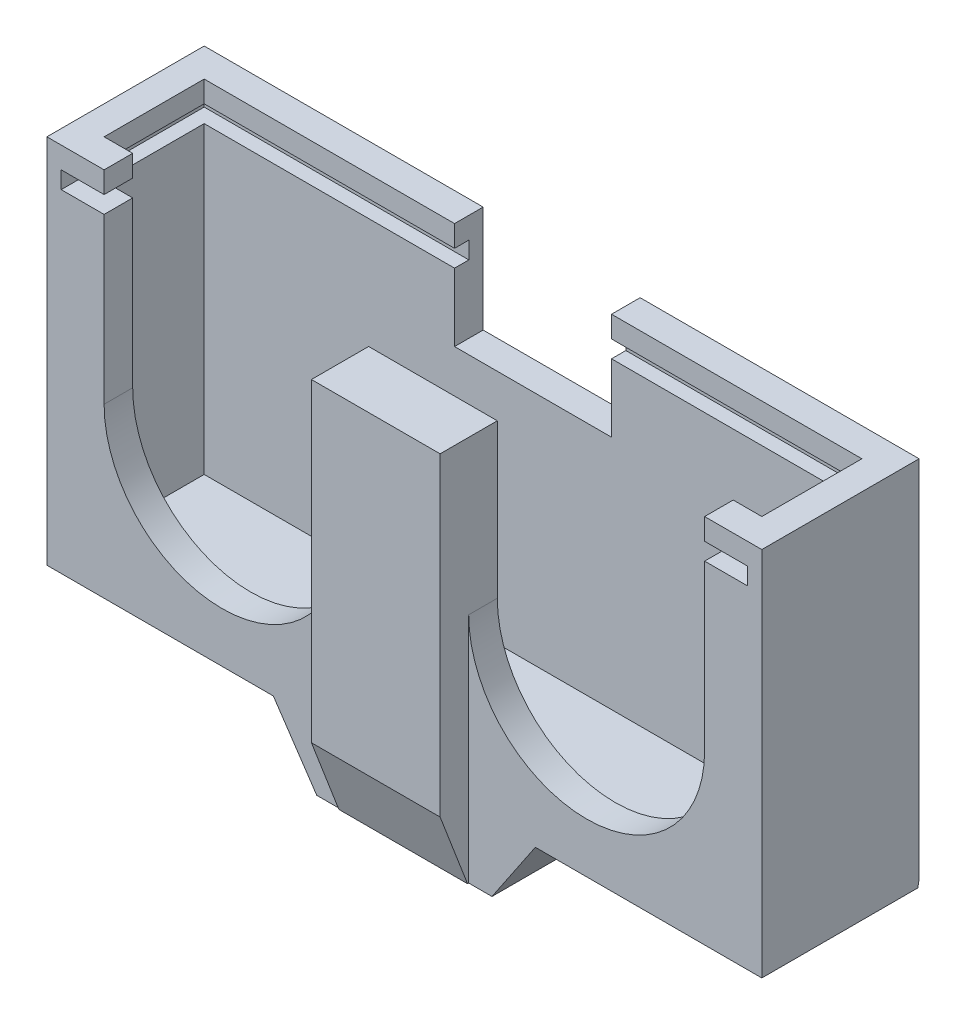
from build123d import *

# Parameters (mm, degrees)
ESBO_O1_W                 = 50
ESBO_O1_H                 = 11
RESSALTO_EXTRUS_O1_DEPTH  = 22.5
ESBO_O2_W                 = 46
ESBO_O2_H                 = 7
CORTE_EXTRUS_O1_DEPTH     = 20.5
ESBO_O3_W                 = 10.97916057
ESBO_O3_H                 = 2
CORTE_EXTRUS_O2_DEPTH     = 4
CORTE_EXTRUS_O3_DEPTH     = 4
ESBO_O9_W                 = 50
ESBO_O9_H                 = 4
RESSALTO_EXTRUS_O4_DEPTH  = 7
ESBO_O13_R                = 1.5
CORTE_EXTRUS_O4_DEPTH     = 7
ESBO_O19_W                = 9
ESBO_O19_H                = 4
RESSALTO_EXTRUS_O5_DEPTH  = 22.5
ESBO_O20_W                = 50
ESBO_O20_H                = 4
CORTE_EXTRUS_O5_DEPTH     = 7
RESSALTO_EXTRUS_O6_DEPTH  = 0.75
RESSALTO_EXTRUS_O7_DEPTH  = 1.2
RESSALTO_EXTRUS_O8_DEPTH  = 1.5
RESSALTO_EXTRUS_O9_DEPTH  = 4.5
ESBO_O26_R                = 2.9
CORTE_EXTRUS_O6_DEPTH     = 4
ESBO_O28_W                = 7
ESBO_O28_H                = 7
RESSALTO_EXTRUS_O10_DEPTH = 4.5
CHANFRO1_SIZE             = 5
CHANFRO1_SIZE_2           = 3.372542584
CHANFRO2_SIZE             = 3.372542584
CHANFRO2_SIZE_2           = 5
CHANFRO3_SIZE             = 5
CHANFRO3_SIZE2            = 0.881634904
CHANFRO4_SIZE             = 5
CHANFRO4_SIZE2            = 1.919320175


with BuildPart() as part:
    # Esboço1 → Ressalto-extrusão1 (new body)
    with BuildSketch(Plane(origin=(0, 0, 0), x_dir=(1, 0, 0), z_dir=(0, 1, 0))):
        Rectangle(ESBO_O1_W, ESBO_O1_H)
    extrude(amount=RESSALTO_EXTRUS_O1_DEPTH)

    # Esboço2 → Corte-extrusão1 (cut)
    with BuildSketch(Plane(origin=(0, 22.5, 0), x_dir=(1, 0, 0), z_dir=(0, 1, 0))):
        Rectangle(ESBO_O2_W, ESBO_O2_H)
    extrude(amount=-CORTE_EXTRUS_O1_DEPTH, mode=Mode.SUBTRACT)

    # Esboço3 → Corte-extrusão2 (cut)
    with BuildSketch(Plane(origin=(0, 22.5, 0), x_dir=(1, 0, 0), z_dir=(0, 1, 0))):
        with Locations((0, 4.5)):
            Rectangle(ESBO_O3_W, ESBO_O3_H)
    extrude(amount=-CORTE_EXTRUS_O2_DEPTH, mode=Mode.SUBTRACT)

    # Esboço5 → Corte-extrusão3 (cut)
    with BuildSketch(Plane.XY.offset(5.5)):
        with BuildLine():
            Line((-21, 22.5), (-4.5, 22.5))
            Line((-4.5, 22.5), (-4.5, 11.75))
            ThreePointArc((-4.5, 11.75), (-12.75, 3.5), (-21, 11.75))
            Line((-21, 11.75), (-21, 22.5))
        make_face()
        with BuildLine():
            Line((4.5, 22.5), (21, 22.5))
            Line((21, 22.5), (21, 11.75))
            ThreePointArc((21, 11.75), (12.75, 3.5), (4.5, 11.75))
            Line((4.5, 11.75), (4.5, 22.5))
        make_face()
    extrude(amount=-CORTE_EXTRUS_O3_DEPTH, mode=Mode.SUBTRACT)

    # Esboço9 → Ressalto-extrusão4 (add)
    with BuildSketch(Plane(origin=(0, 0, -5.5), x_dir=(-1, 0, 0), z_dir=(0, 0, -1))):
        with Locations((0, 2)):
            Rectangle(ESBO_O9_W, ESBO_O9_H)
    extrude(amount=RESSALTO_EXTRUS_O4_DEPTH)

    # Esboço13 → Corte-extrusão4 (cut)
    with BuildSketch(Plane(origin=(0, 4, 0), x_dir=(1, 0, 0), z_dir=(0, 1, 0))):
        with Locations(Location((10, 9, 0), (0, 0, 270))):
            Circle(ESBO_O13_R)
        with Locations(Location((5, 9, 0), (0, 0, 270))):
            Circle(ESBO_O13_R)
        with Locations(Location((20, 9, 0), (0, 0, 270))):
            Circle(ESBO_O13_R)
        with Locations(Location((15, 9, 0), (0, 0, 270))):
            Circle(ESBO_O13_R)
        with Locations(Location((0, 9, 0), (0, 0, 270))):
            Circle(ESBO_O13_R)
        with Locations(Location((-5, 9, 0), (0, 0, 270))):
            Circle(ESBO_O13_R)
        with Locations(Location((-10, 9, 0), (0, 0, 270))):
            Circle(ESBO_O13_R)
        with Locations(Location((-15, 9, 0), (0, 0, 270))):
            Circle(ESBO_O13_R)
        with Locations(Location((-20, 9, 0), (0, 0, 270))):
            Circle(ESBO_O13_R)
    extrude(amount=-CORTE_EXTRUS_O4_DEPTH, mode=Mode.SUBTRACT)

    # Esboço19 → Ressalto-extrusão5 (add)
    with BuildSketch(Plane(origin=(0, 22.5, 0), x_dir=(1, 0, 0), z_dir=(0, 1, 0))):
        with Locations((0, -5.5)):
            Rectangle(ESBO_O19_W, ESBO_O19_H)
    extrude(amount=-RESSALTO_EXTRUS_O5_DEPTH)

    # Esboço20 → Corte-extrusão5 (cut)
    with BuildSketch(Plane(origin=(0, 0, -12.5), x_dir=(-1, 0, 0), z_dir=(0, 0, -1))):
        with Locations((0, 2)):
            Rectangle(ESBO_O20_W, ESBO_O20_H)
    extrude(amount=-CORTE_EXTRUS_O5_DEPTH, mode=Mode.SUBTRACT)

    # Esboço21 → Ressalto-extrusão6 (add)
    with BuildSketch(Plane(origin=(0, 22.5, 0), x_dir=(1, 0, 0), z_dir=(0, 1, 0))):
        Polygon((-21, -5.5), (-21, -3.5), (-23, -3.5), (-23, 3.5), (-5.489580285, 3.5), (-5.489580285, 5.5), (-25, 5.5), (-25, -5.5), align=None)
        Polygon((21, -3.5), (21, -5.5), (25, -5.5), (25, 5.5), (5.489580285, 5.5), (5.489580285, 3.5), (23, 3.5), (23, -3.5), align=None)
    extrude(amount=RESSALTO_EXTRUS_O6_DEPTH)

    # Esboço22 → Ressalto-extrusão7 (add)
    with BuildSketch(Plane(origin=(0, 23.25, 0), x_dir=(1, 0, 0), z_dir=(0, 1, 0))):
        Polygon((-24, 3.5), (-24, -5.5), (-25, -5.5), (-25, 5.5), (-5.489580285, 5.5), (-5.489580285, 4.5), (-23, 4.5), (-24, 4.5), align=None)
        Polygon((23, 4.5), (5.489580285, 4.5), (5.489580285, 5.5), (25, 5.5), (25, -5.5), (24, -5.5), (24, 3.5), (24, 4.5), align=None)
    extrude(amount=RESSALTO_EXTRUS_O7_DEPTH)

    # Esboço23 → Ressalto-extrusão8 (add)
    with BuildSketch(Plane(origin=(0, 24.45, 0), x_dir=(1, 0, 0), z_dir=(0, 1, 0))):
        Polygon((-24, 4.5), (-24, -5.5), (-25, -5.5), (-25, 5.5), (-5.489580285, 5.5), (-5.489580285, 4.5), align=None)
        Polygon((-23, 3.5), (-5.489580285, 3.5), (-5.489580285, 4.5), (-24, 4.5), (-24, -5.5), (-21, -5.5), (-21, -3.5), (-23, -3.5), align=None)
        Polygon((5.489580285, 5.5), (5.489580285, 4.5), (24, 4.5), (24, -5.5), (25, -5.5), (25, 5.5), align=None)
        Polygon((23, -3.5), (21, -3.5), (21, -5.5), (24, -5.5), (24, 4.5), (5.489580285, 4.5), (5.489580285, 3.5), (23, 3.5), align=None)
    extrude(amount=RESSALTO_EXTRUS_O8_DEPTH)

    # Esboço24 → Ressalto-extrusão9 (add)
    with BuildSketch(Plane.XZ):
        Polygon((0, 3.5), (-3.5, 3.5), (-3.5, 0), (-3.5, -3.5), (3.5, -3.5), (3.5, 3.5), align=None)
    extrude(amount=RESSALTO_EXTRUS_O9_DEPTH)

    # Esboço26 → Corte-extrusão6 (cut)
    with BuildSketch(Plane.XZ.offset(4.5)):
        with Locations(Location((0, 0, 0), (0, 0, 270))):
            Circle(ESBO_O26_R)
    extrude(amount=-CORTE_EXTRUS_O6_DEPTH, mode=Mode.SUBTRACT)

    # Esboço28 → Ressalto-extrusão10 (add)
    with BuildSketch(Plane.XZ):
        Polygon((-4.5, 5.5), (-9.5, 5.5), (-9.5, -5.5), (9.5, -5.5), (9.5, 5.5), (4.5, 5.5), (4.5, 7.5), (-4.5, 7.5), align=None)
        Rectangle(ESBO_O28_W, ESBO_O28_H, mode=Mode.SUBTRACT)
    extrude(amount=RESSALTO_EXTRUS_O10_DEPTH)

    # Chanfro1
    # the kernel refuses this chamfer: 5, 3.372542584 mm, written as the material it adds along each edge
    # the kernel refuses this chamfer: 5, 3.372542584 mm, written as the material it takes off along each edge
    with BuildSketch(Plane(origin=(-9.5, -4.5, 18.417545032), x_dir=(-0.021644705014774095, 0.9997657259302418, 0), z_dir=(0, 0, -1))) as chanfro1_2_piece_1_section:
        Polygon((CHANFRO1_SIZE * 0.99976572593, CHANFRO1_SIZE * 0.0216447050148), (-CHANFRO1_SIZE_2 * 0.0216447050161, CHANFRO1_SIZE_2 * 0.999765725993), (0, 0), align=None)
    chanfro1_2_piece_1 = extrude(amount=36.835090064, mode=Mode.PRIVATE)
    chanfro1_2_piece_1 = split(chanfro1_2_piece_1, bisect_by=Plane(origin=(-8.365599313, 0, 0), z_dir=(0, -1, 0)), keep=Keep.TOP, mode=Mode.PRIVATE)
    add(chanfro1_2_piece_1, mode=Mode.SUBTRACT)

    # Chanfro2
    # the kernel refuses this chamfer: 5, 3.372542584 mm, written as the material it takes off along each edge
    with BuildSketch(Plane(origin=(9.5, -4.5, -18.417545032), x_dir=(-0.9988697089125116, -0.04753214298802805, 0), z_dir=(0, 0, 1))) as chanfro2_piece_1_section:
        Polygon((CHANFRO2_SIZE * 0.998869708975, -CHANFRO2_SIZE * 0.047532142991), (-CHANFRO2_SIZE_2 * 0.047532142988, -CHANFRO2_SIZE_2 * 0.998869708913), (0, 0), align=None)
    chanfro2_piece_1 = extrude(amount=36.835090064, mode=Mode.PRIVATE)
    chanfro2_piece_1 = split(chanfro2_piece_1, bisect_by=Plane(origin=(8.383687283, 0, 0), z_dir=(0, -1, 0)), keep=Keep.TOP, mode=Mode.PRIVATE)
    add(chanfro2_piece_1, mode=Mode.SUBTRACT)

    # Chanfro3
    chanfro3_edges = [part.edges().sort_by_distance(p)[0] for p in [
        (0, -4.5, -5.5),
    ]]
    chanfro3_side = [part.faces().sort_by_distance(p)[0] for p in [
        (0, 11.578416309, -5.5),
    ]]
    chamfer(chanfro3_edges, length=CHANFRO3_SIZE, length2=CHANFRO3_SIZE2, reference=chanfro3_side[0])

    # Chanfro4
    chanfro4_edges = [part.edges().sort_by_distance(p)[0] for p in [
        (0, -4.5, 7.5),
    ]]
    chanfro4_side = [part.faces().sort_by_distance(p)[0] for p in [
        (0, 9, 7.5),
    ]]
    chamfer(chanfro4_edges, length=CHANFRO4_SIZE, length2=CHANFRO4_SIZE2, reference=chanfro4_side[0])


solid = part.part
